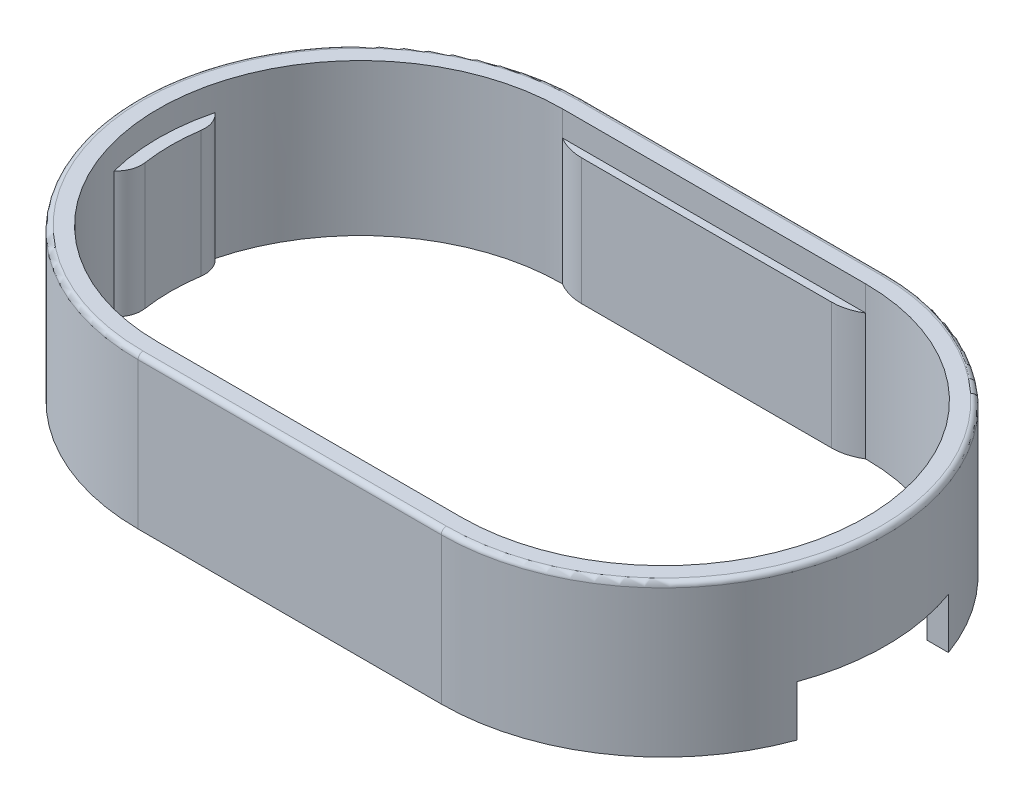
from build123d import *

# Parameters (mm, degrees)
BOSS_EXTRUDE1_DEPTH = 30
SHELL1_T            = -4
SKETCH3_W           = 60
SKETCH3_H           = 1.5
BOSS_EXTRUDE2_DEPTH = 25
BOSS_EXTRUDE3_DEPTH = 25
FILLET2_R           = 10
BOSS_EXTRUDE5_DEPTH = 25
FILLET5_R           = 5
FILLET6_R           = 1
SKETCH9_W           = 17
SKETCH9_H           = 30
CUT_EXTRUDE1_DEPTH  = 10


with BuildPart() as part:
    # Sketch1 → Boss-Extrude1 (new body)
    with BuildSketch(Plane(origin=(0, 0, 0), x_dir=(1, 0, 0), z_dir=(0, 1, 0))):
        with BuildLine():
            Line((0, 0), (60, 0))
            ThreePointArc((60, 0), (104, 44), (60, 88))
            Line((60, 88), (0, 88))
            ThreePointArc((0, 88), (-44, 44), (0, 0))
        make_face()
    extrude(amount=BOSS_EXTRUDE1_DEPTH)

    # Shell1
    shell1_openings = [part.faces().sort_by_distance(p)[0] for p in [
        (30, 30, -44),
        (30, 0, -44),
    ]]
    offset(amount=SHELL1_T, openings=shell1_openings, kind=Kind.INTERSECTION)

    # Sketch3 → Boss-Extrude2 (add)
    with BuildSketch(Plane.XZ):
        with Locations((30, -4.75)):
            Rectangle(SKETCH3_W, SKETCH3_H)
    extrude(amount=-BOSS_EXTRUDE2_DEPTH)

    # Sketch5 → Boss-Extrude3 (add)
    with BuildSketch(Plane.XZ):
        Polygon((0, -84), (0, -82.5), (60.003782522, -82.5), (60, -84), align=None)
    extrude(amount=-BOSS_EXTRUDE3_DEPTH)

    # Fillet2
    # the kernel refuses this fillet: 10 mm, written as the material it takes off along each edge
    with BuildSketch(Plane(origin=(60, -13.169567191, -5.5), x_dir=(0, 0, 1), z_dir=(0, 1, 0)), Plane(origin=(0, -13.169567191, -82.5), x_dir=(0, 0, -1), z_dir=(0, 1, 0))) as fillet2_piece_1:
        with BuildLine():
            CenterArc((10, -5.267826876), FILLET2_R, 148.211669383, 31.788330617)
            Line((0, -5.267826876), (-0.2, -5.267826876))
            Line((-0.2, -5.267826876), (-0.2, 0))
            Line((-0.2, 0), (0, 0.2))
            ThreePointArc((0, 0.2), (0.75, 0.2), (1.33, 0.105356538))
            Line((1.33, 0.105356538), (1.5, 0))
        make_face()
    extrude(amount=51.339134382, mode=Mode.SUBTRACT)
    with BuildSketch(Plane(origin=(60.003782522, -13.179023495, -82.5), x_dir=(-1, 0, 0), z_dir=(0, 1, 0))) as fillet2_piece_2:
        with BuildLine():
            CenterArc((5.271609398, -10), FILLET2_R, 90, 31.788330617)
            Line((0.003782522, -1.5), (-0.101574016, -1.33))
            ThreePointArc((-0.101574016, -1.33), (-0.198108103, -0.750504335), (-0.199999364, -0.000504335))
            Line((-0.199999364, -0.000504335), (0, 0.2))
            Line((0, 0.2), (5.271609398, 0.2))
            Line((5.271609398, 0.2), (5.271609398, 0))
        make_face()
    extrude(amount=51.358046991, mode=Mode.SUBTRACT)
    with BuildSketch(Plane(origin=(0, -13.169567191, -5.5), x_dir=(1, 0, 0), z_dir=(0, 1, 0))) as fillet2_piece_3:
        with BuildLine():
            CenterArc((5.267826876, -10), FILLET2_R, 90, 31.788330617)
            Line((0, -1.5), (-0.105356538, -1.33))
            ThreePointArc((-0.105356538, -1.33), (-0.2, -0.75), (-0.2, 0))
            Line((-0.2, 0), (0, 0.2))
            Line((0, 0.2), (5.267826876, 0.2))
            Line((5.267826876, 0.2), (5.267826876, 0))
        make_face()
    extrude(amount=51.339134382, mode=Mode.SUBTRACT)

    # Sketch8 → Boss-Extrude5 (add)
    with BuildSketch(Plane.XZ):
        with BuildLine():
            Line((96.142080737, -34), (98.729833462, -34))
            ThreePointArc((98.729833462, -34), (100, -44), (98.729833462, -54))
            Line((98.729833462, -54), (96.142080737, -54))
            ThreePointArc((96.142080737, -54), (97.5, -44), (96.142080737, -34))
        make_face()
        with BuildLine():
            Line((-36.142080737, -54), (-38.729833462, -54))
            ThreePointArc((-38.729833462, -54), (-40, -44), (-38.729833462, -34))
            Line((-38.729833462, -34), (-36.142080737, -34))
            ThreePointArc((-36.142080737, -34), (-37.5, -44), (-36.142080737, -54))
        make_face()
    extrude(amount=-BOSS_EXTRUDE5_DEPTH)

    # Fillet5
    # the kernel refuses this fillet: 5 mm, written as the material it takes off along each edge
    with BuildSketch(Plane(origin=(96.142080737, -11.460527233, -34), x_dir=(1, 0, 0), z_dir=(0, 1, 0)), Plane(origin=(-36.142080737, -11.460527233, -54), x_dir=(-1, 0, 0), z_dir=(0, 1, 0))) as fillet5_piece_1:
        with BuildLine():
            CenterArc((5.895743435, 3.749292929), FILLET5_R, 171.542516957, 57.035612676)
            Line((0.950117062, 4.484670231), (0.851204534, 4.499377777))
            ThreePointArc((0.851204534, 4.499377777), (0.445822951, 2.248528932), (-0.096378882, 0.026666667))
            Line((-0.096378882, 0.026666667), (0, -0.1))
            ThreePointArc((0, -0.1), (1.293876363, -0.1), (2.521592911, -0.074985859))
            Line((2.521592911, -0.074985859), (2.587752725, 0))
        make_face()
    extrude(amount=47.921054465, mode=Mode.SUBTRACT)
    with BuildSketch(Plane(origin=(96.142080737, -11.460527233, -54), x_dir=(1, 0, 0), z_dir=(0, 1, 0)), Plane(origin=(-36.142080737, -11.460527233, -34), x_dir=(-1, 0, 0), z_dir=(0, 1, 0))) as fillet5_piece_2:
        with BuildLine():
            CenterArc((5.895743435, -3.749292929), FILLET5_R, 131.421870366, 57.035612676)
            Line((0.950117062, -4.484670231), (0.851204534, -4.499377777))
            ThreePointArc((0.851204534, -4.499377777), (0.445822951, -2.248528932), (-0.096378882, -0.026666667))
            Line((-0.096378882, -0.026666667), (0, 0.1))
            ThreePointArc((0, 0.1), (1.293876363, 0.1), (2.521592911, 0.074985859))
            Line((2.521592911, 0.074985859), (2.587752725, 0))
        make_face()
    extrude(amount=47.921054465, mode=Mode.SUBTRACT)

    # Fillet6
    fillet6_edges = [part.edges().sort_by_distance(p)[0] for p in [
        (104, 30, -44),
        (30, 30, -88),
        (-44, 30, -44),
        (30, 30, 0),
    ]]
    fillet(fillet6_edges, radius=FILLET6_R)

    # Sketch9 → Cut-Extrude1 (cut)
    with BuildSketch(Plane.XZ):
        with Locations((102.218118592, -44)):
            Rectangle(SKETCH9_W, SKETCH9_H)
    extrude(amount=-CUT_EXTRUDE1_DEPTH, mode=Mode.SUBTRACT)


solid = part.part
